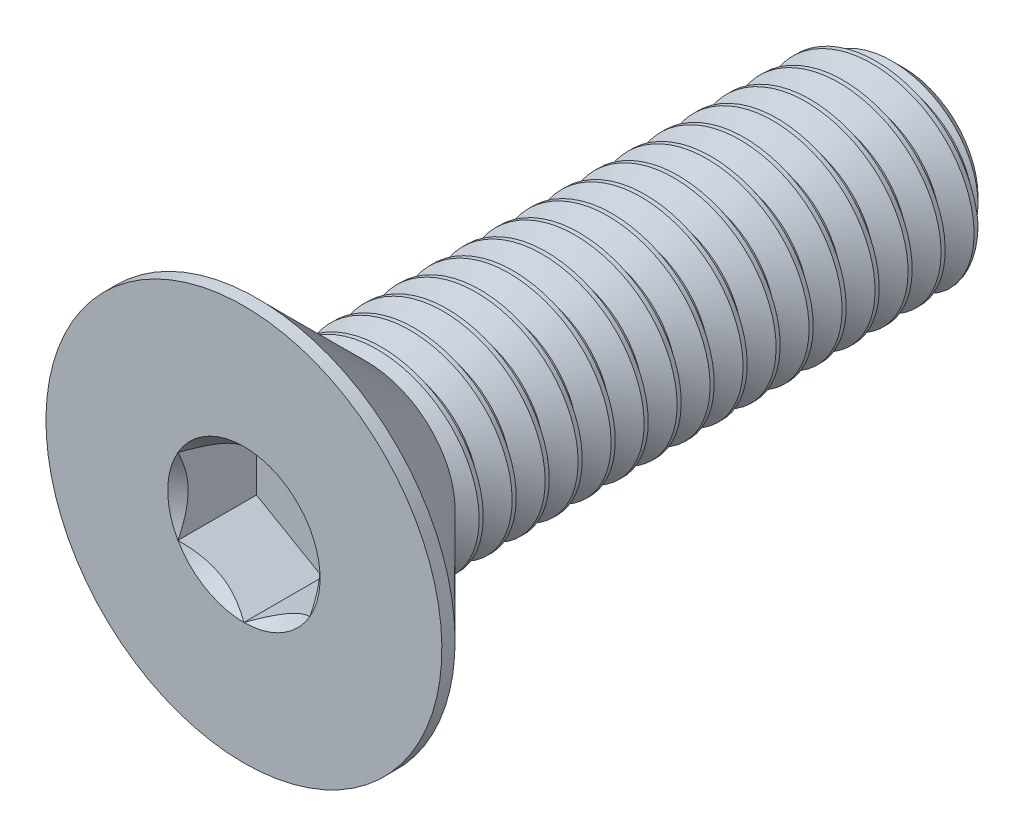
from build123d import *
from build123d.topology import SkipClean

# Parameters (mm, degrees)
SKETCH1_W          = 10
SKETCH1_H          = 1.5
CHAMFER1_SIZE      = 0.375
CUT_SWEEP1_PITCH   = 0.5
CUT_EXTRUDE2_DEPTH = 1.19


with BuildPart() as part:
    # Sketch1 → Revolve1 (revolve)
    with BuildSketch(Plane(origin=(0, 0, 0), x_dir=(0, 0, -1), z_dir=(1, 0, 0))):
        with Locations((5, 0.75)):
            Rectangle(SKETCH1_W, SKETCH1_H)
    revolve(axis=Axis((0, 0, -10), (0, 0, 1)))

    # Chamfer1
    chamfer1_edges = [part.edges().sort_by_distance(p)[0] for p in [
        (0, -1.5, -10),
    ]]
    chamfer(chamfer1_edges, length=CHAMFER1_SIZE)

    # Cut-Sweep1: the profile of Sketch2 profile screwed along a right-hand helix of 20 turns, 6 arcs to a turn; built about Z, then put on its axis
    cut_sweep1_z = Axis((0, 0, 0), (0, 0, 1))
    cut_sweep1_corners = [(1.5003, 0, 0.000173205), (1.5003, 0, -0.437673205), (1.175240474, 0, -0.25), (1.175240474, 0, -0.1875)]
    with BuildLine(mode=Mode.PRIVATE) as cut_sweep1_profile:
        Line(cut_sweep1_corners[0], cut_sweep1_corners[1])
        Line(cut_sweep1_corners[1], cut_sweep1_corners[2])
        Line(cut_sweep1_corners[2], cut_sweep1_corners[3])
        Line(cut_sweep1_corners[3], cut_sweep1_corners[0])
    cut_sweep1_cap = Face(cut_sweep1_profile.wire())
    cut_sweep1_turn_angles = [0, 30, 60, 90, 120, 150, 180, 210, 240, 270, 300, 330, 360]
    cut_sweep1_turn_weights = [1, 0.8660254037844387, 1, 0.8660254037844387, 1, 0.8660254037844387, 1, 0.8660254037844387, 1, 0.8660254037844387, 1, 0.8660254037844387, 1]
    cut_sweep1_turn_rails = [Edge.make_bspline([Vector(p[0], p[1], 0).rotate(cut_sweep1_z, cut_sweep1_turn_angles[k]) / cut_sweep1_turn_weights[k] + Vector(0, 0, p[2] + CUT_SWEEP1_PITCH * cut_sweep1_turn_angles[k] / 360) for k in range(13)], [0, 0, 0, 1, 1, 2, 2, 3, 3, 4, 4, 5, 5, 6, 6, 6], 2, cut_sweep1_turn_weights) for p in cut_sweep1_corners]
    cut_sweep1_turn_sides = [Face.make_surface_from_curves(cut_sweep1_turn_rails[p[0]], cut_sweep1_turn_rails[p[1]]) for p in [(0, 1), (1, 2), (2, 3), (3, 0)]]
    cut_sweep1 = Plane(origin=(0, 0, -10), x_dir=(0, 1, 0), z_dir=(0, 0, 1)) * Solid(Shell([*[p.moved(Location((0, 0, CUT_SWEEP1_PITCH * i))) for i in range(20) for p in cut_sweep1_turn_sides], cut_sweep1_cap, cut_sweep1_cap.rotate(cut_sweep1_z, 7200).moved(Location((0, 0, CUT_SWEEP1_PITCH * 7200 / 360)))]))
    add(cut_sweep1, mode=Mode.SUBTRACT)

    # Sketch7 → Revolve2 (revolve)
    with BuildSketch(Plane(origin=(0, 0, 0), x_dir=(0, 0, -1), z_dir=(1, 0, 0)), mode=Mode.PRIVATE) as revolve2_sk:
        Polygon((0, 3), (0.2, 3), (1.7, 1.5), (1.7, 0), (0, 0), align=None)
    revolve(revolve2_sk.sketch.rotate(Axis((0, 0, 0), (0, 0, -1)), 180), axis=Axis((0, 0, 0), (0, 0, -1)))

    # Boss-Extrude1 cone 1 section (through the dimple's axis) → Boss-Extrude1 (revolve)
    with SkipClean():  # the faces are left unmerged after this step: merging them gives an invalid solid
        with BuildSketch(Plane(origin=(0, 0, -1.7), x_dir=(0, -1, 0), z_dir=(1, 0, 0))):
            Polygon((0, 0), (1.5, 0), (0, 1.5), align=None)
        revolve(axis=Axis((0, 0, -1.7), (0, 0, -1)))

    # Sketch5 → Cut-Extrude2 (cut)
    with SkipClean():  # the faces are left unmerged after this step: merging them gives an invalid solid
        with BuildSketch(Plane.XY):
            Polygon((1, -0.577350269), (1, 0.577350269), (0, 1.154700538), (-1, 0.577350269), (-1, -0.577350269), (0, -1.154700538), align=None)
        extrude(amount=-CUT_EXTRUDE2_DEPTH, mode=Mode.SUBTRACT)

    # Cut-Extrude3 cone 1 section (through the dimple's axis) → Cut-Extrude3 (revolve, cut)
    with SkipClean():  # the faces are left unmerged after this step: merging them gives an invalid solid
        with BuildSketch(Plane(origin=(0, 0, 0), x_dir=(0, -1, 0), z_dir=(1, 0, 0))):
            Polygon((0, 0), (1.154700538, 0), (0, 1.154700538), align=None)
        revolve(axis=Axis((0, 0, 0), (0, 0, -1)), mode=Mode.SUBTRACT)


solid = part.part
